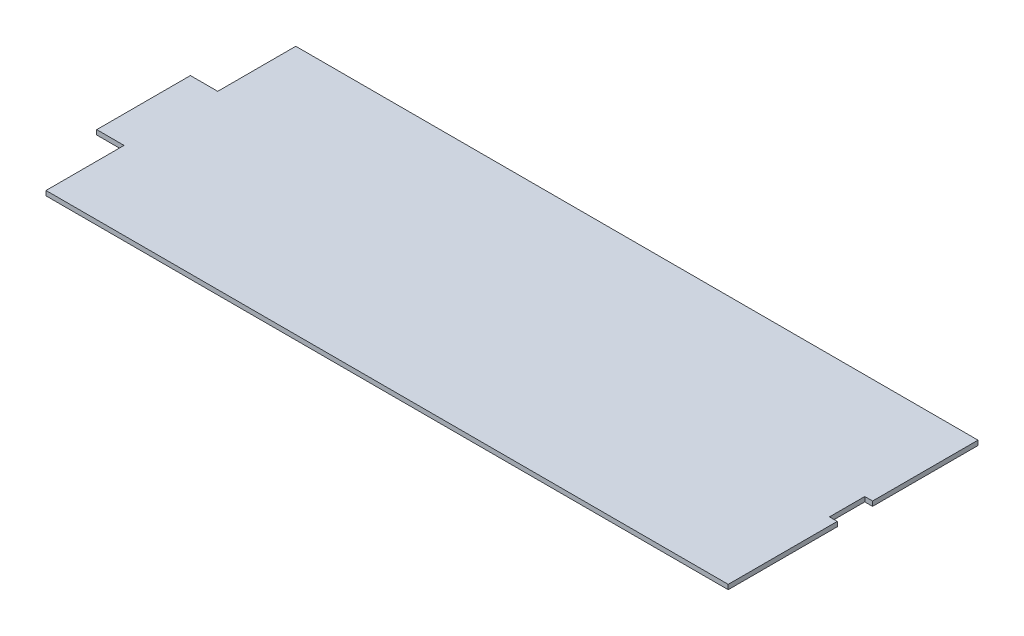
from build123d import *

# Parameters (mm, degrees)
BOSS_EXTRUDE1_START = 2
BOSS_EXTRUDE1_DEPTH = 3


with BuildPart() as part:
    # Sketch1 → Boss-Extrude1 (new body)
    with BuildSketch(Plane(origin=(0, 0, 0), x_dir=(1, 0, 0), z_dir=(0, 1, 0)).offset(BOSS_EXTRUDE1_START)):
        Polygon((-261.622946406, 30), (-279.122946406, 30), (-279.122946406, -30), (-261.622946406, -30), (-261.622946406, -80), (175.377053594, -80), (175.377053594, -10.137908587), (170.377053594, -10.137908587), (170.377053594, 12.462091413), (175.377053594, 12.462091413), (175.377053594, 80), (-261.622946406, 80), align=None)
    extrude(amount=BOSS_EXTRUDE1_DEPTH)


solid = part.part
